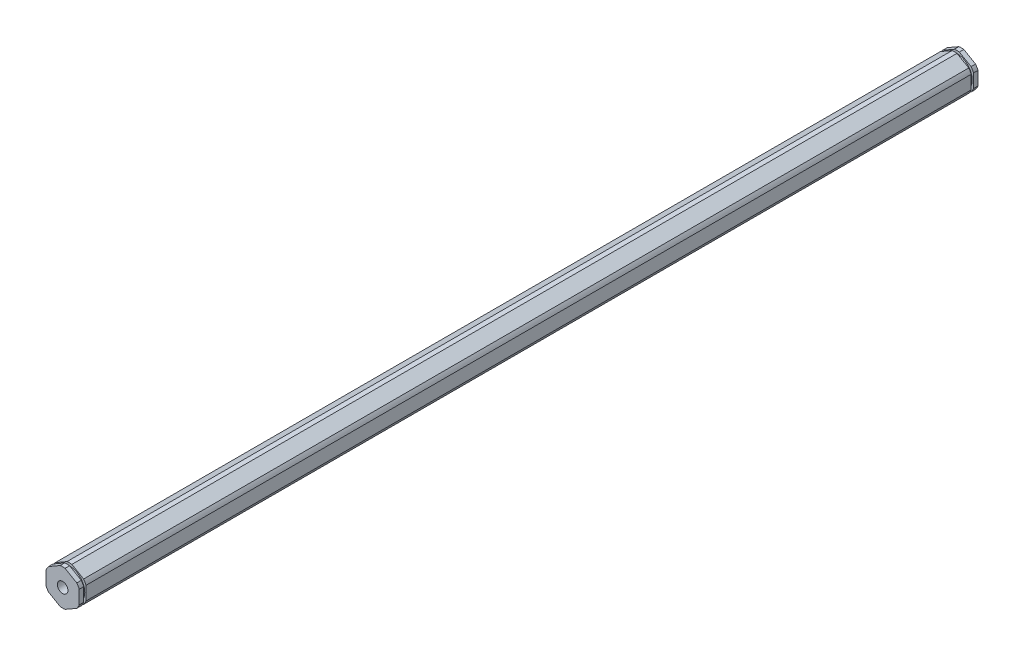
from build123d import *

# Parameters (mm, degrees)
BOSS_EXTRUDE1_DEPTH                  = 171.67225
F_10_32_TAPPED_HOLE1_D               = 4.0386
F_10_32_TAPPED_HOLE1_DEPTH           = 16.34744
F_10_32_TAPPED_HOLE1_TIP             = 1.213317848
F_10_32_TAPPED_HOLE1_ON_FACE_2_D     = 4.0386
F_10_32_TAPPED_HOLE1_ON_FACE_2_DEPTH = 16.34744
F_10_32_TAPPED_HOLE1_ON_FACE_2_TIP   = 1.213317848
SKETCH5_W                            = 0.889
SKETCH5_H                            = 1.0033


with BuildPart() as part:
    # Sketch1 → Boss-Extrude1 (new, symmetric)
    with BuildSketch(Plane.XY):
        with BuildLine():
            ThreePointArc((0.93173274, 6.79441227), (0, 6.858), (-0.93173274, 6.79441227))
            Line((-0.93173274, 6.79441227), (-5.41826726, 4.204110358))
            ThreePointArc((-5.41826726, 4.204110358), (-5.939202219, 3.429), (-6.35, 2.590301913))
            Line((-6.35, 2.590301913), (-6.35, -2.590301913))
            ThreePointArc((-6.35, -2.590301913), (-5.939202219, -3.429), (-5.41826726, -4.204110358))
            Line((-5.41826726, -4.204110358), (-0.93173274, -6.79441227))
            ThreePointArc((-0.93173274, -6.79441227), (0, -6.858), (0.93173274, -6.79441227))
            Line((0.93173274, -6.79441227), (5.41826726, -4.204110358))
            ThreePointArc((5.41826726, -4.204110358), (5.939202219, -3.429), (6.35, -2.590301913))
            Line((6.35, -2.590301913), (6.35, 2.590301913))
            ThreePointArc((6.35, 2.590301913), (5.939202219, 3.429), (5.41826726, 4.204110358))
            Line((5.41826726, 4.204110358), (0.93173274, 6.79441227))
        make_face()
    extrude(amount=BOSS_EXTRUDE1_DEPTH, both=True)

    # #10-32 Tapped Hole1
    with Locations(Plane.XY.offset(171.67225)):
        with Locations((0, 0)):
            Hole(F_10_32_TAPPED_HOLE1_D / 2, depth=F_10_32_TAPPED_HOLE1_DEPTH)
            with Locations((0, 0, -(F_10_32_TAPPED_HOLE1_DEPTH + F_10_32_TAPPED_HOLE1_TIP / 2))):  # 118° drill point
                Cone(0, F_10_32_TAPPED_HOLE1_D / 2, F_10_32_TAPPED_HOLE1_TIP, mode=Mode.SUBTRACT)

    # #10-32 Tapped Hole1 on face 2
    with Locations(Plane(origin=(0, 0, -171.67225), x_dir=(-1, 0, 0), z_dir=(0, 0, -1))):
        with Locations((0, 0)):
            Hole(F_10_32_TAPPED_HOLE1_ON_FACE_2_D / 2, depth=F_10_32_TAPPED_HOLE1_ON_FACE_2_DEPTH)
            with Locations((0, 0, -(F_10_32_TAPPED_HOLE1_ON_FACE_2_DEPTH + F_10_32_TAPPED_HOLE1_ON_FACE_2_TIP / 2))):  # 118° drill point
                Cone(0, F_10_32_TAPPED_HOLE1_ON_FACE_2_D / 2, F_10_32_TAPPED_HOLE1_ON_FACE_2_TIP, mode=Mode.SUBTRACT)

    # Sketch5 → Cut-Revolve1 (revolve, cut)
    with BuildSketch(Plane(origin=(0, 0, 0), x_dir=(0, 0, -1), z_dir=(1, 0, 0))):
        with Locations((-169.51325, 6.35635)):
            Rectangle(SKETCH5_W, SKETCH5_H)
    cut_revolve1 = revolve(axis=Axis((0, 0, 165.047176272), (0, 0, -1)), mode=Mode.SUBTRACT)

    # Mirror1: Cut-Revolve1 across plane
    add(cut_revolve1.mirror(Plane.XY), mode=Mode.SUBTRACT)


solid = part.part
